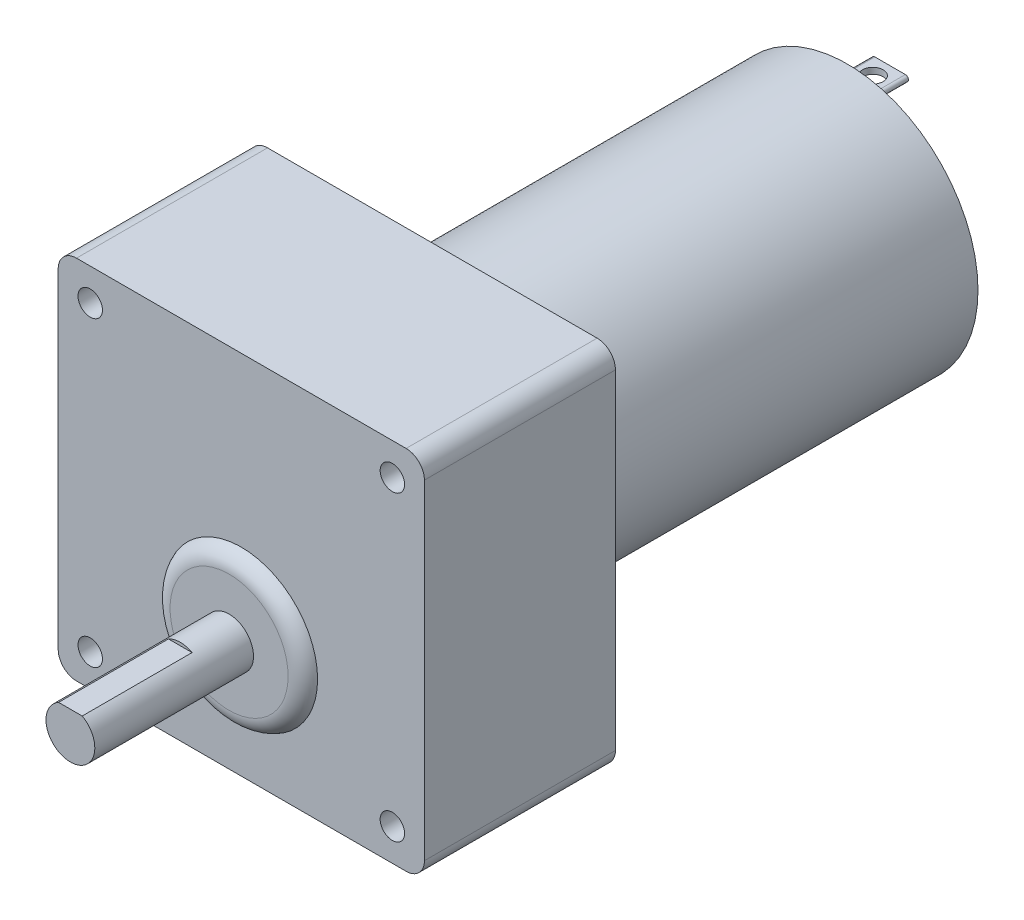
from build123d import *

# Parameters (mm, degrees)
SKETCH1_R           = 21.4
BOSS_EXTRUDE1_DEPTH = 68
SKETCH2_W           = 60
SKETCH2_H           = 60
SKETCH2_R           = 2
BOSS_EXTRUDE2_DEPTH = 31.3
SKETCH3_R           = 12.5
BOSS_EXTRUDE3_DEPTH = 2
FILLET1_R           = 3
SKETCH4_R           = 4
BOSS_EXTRUDE4_DEPTH = 8
BOSS_EXTRUDE5_DEPTH = 18
FILLET2_R           = 3
BOSS_EXTRUDE6_DEPTH = 7
CUT_EXTRUDE1_REACH  = 141.197
SKETCH7_R           = 1.686317599


with BuildPart() as part:
    # Sketch1 → Boss-Extrude1 (new body)
    with BuildSketch(Plane.XY):
        Circle(SKETCH1_R)
    extrude(amount=BOSS_EXTRUDE1_DEPTH)

    # Sketch2 → Boss-Extrude2 (add)
    with BuildSketch(Plane.XY.offset(68)):
        Rectangle(SKETCH2_W, SKETCH2_H)
        with Locations((-24.75, 24.75)):
            Circle(SKETCH2_R, mode=Mode.SUBTRACT)
        with Locations((24.75, 24.75)):
            Circle(SKETCH2_R, mode=Mode.SUBTRACT)
        with Locations(Location((24.75, -24.75, 0), (0, 0, 180))):
            Circle(SKETCH2_R, mode=Mode.SUBTRACT)
        with Locations(Location((-24.75, -24.75, 0), (0, 0, 180))):
            Circle(SKETCH2_R, mode=Mode.SUBTRACT)
    extrude(amount=BOSS_EXTRUDE2_DEPTH)

    # Sketch3 → Boss-Extrude3 (add)
    with BuildSketch(Plane.XY.offset(99.3)):
        with Locations((0, -10)):
            Circle(SKETCH3_R)
    extrude(amount=BOSS_EXTRUDE3_DEPTH)

    # Fillet1
    # the kernel refuses this fillet: 3 mm, written as the material it takes off along each edge
    with BuildSketch(Plane(origin=(0, -10, 101.3), x_dir=(1, 0, 0), z_dir=(0, -1, 0))) as fillet1_piece_1:
        with BuildLine():
            CenterArc((9.671572875, -3), FILLET1_R, 19.471220634, 70.528779366)
            Line((9.671572875, 0), (9.671572875, 0.06))
            Line((9.671572875, 0.06), (12.5, 0.06))
            Line((12.5, 0.06), (12.56, 0))
            ThreePointArc((12.56, 0), (12.56, -1), (12.556568542, -1.98))
            Line((12.556568542, -1.98), (12.5, -2))
        make_face()
    revolve(axis=Axis((0, -10, 101.3), (0, 0, 1)), mode=Mode.SUBTRACT)

    # Sketch4 → Boss-Extrude4 (add)
    with BuildSketch(Plane.XY.offset(101.3)):
        with Locations((0, -10)):
            Circle(SKETCH4_R)
    extrude(amount=BOSS_EXTRUDE4_DEPTH)

    # Sketch5 → Boss-Extrude5 (add)
    with BuildSketch(Plane.XY.offset(109.3)):
        with BuildLine():
            Line((1.936491673, -6.5), (-1.936491673, -6.5))
            ThreePointArc((-1.936491673, -6.5), (-2.031506006, -13.445719569), (4, -10))
            ThreePointArc((4, -10), (3.445719569, -7.968493994), (1.936491673, -6.5))
        make_face()
    extrude(amount=BOSS_EXTRUDE5_DEPTH)

    # Fillet2
    fillet2_edges = [part.edges().sort_by_distance(p)[0] for p in [
        (-30, -30, 83.65),
        (30, -30, 83.65),
        (30, 30, 83.65),
        (-30, 30, 83.65),
    ]]
    fillet(fillet2_edges, radius=FILLET2_R)

    # Sketch6 → Boss-Extrude6 (add)
    with BuildSketch(Plane(origin=(0, 0, 0), x_dir=(-1, 0, 0), z_dir=(0, 0, -1))):
        with BuildLine():
            Line((-2.5, 17.65), (2.5, 17.65))
            ThreePointArc((2.5, 17.65), (3, 17.15), (2.5, 16.65))
            Line((2.5, 16.65), (-2.5, 16.65))
            ThreePointArc((-2.5, 16.65), (-3, 17.15), (-2.5, 17.65))
        make_face()
        with BuildLine():
            Line((-2.5, -17.65), (2.5, -17.65))
            ThreePointArc((2.5, -17.65), (3, -17.15), (2.5, -16.65))
            Line((2.5, -16.65), (-2.5, -16.65))
            ThreePointArc((-2.5, -16.65), (-3, -17.15), (-2.5, -17.65))
        make_face()
    extrude(amount=BOSS_EXTRUDE6_DEPTH)

    # Cut-Extrude1: up to this face of the body (flat: up to its plane)
    cut_extrude1_end = Plane(part.part.faces().sort_by_distance((0, -17.65, -3.5))[0])
    # Sketch7 → Cut-Extrude1 (cut, up to the picked face)
    with BuildSketch(Plane(origin=(0, 17.65, 0), x_dir=(1, 0, 0), z_dir=(0, 1, 0)), mode=Mode.PRIVATE) as cut_extrude1_sk1:
        with Locations(Location((0, 4.176322203, 0), (0, 0, 270))):
            Circle(SKETCH7_R)
    cut_extrude1_tool1 = split(extrude(cut_extrude1_sk1.sketch, amount=-CUT_EXTRUDE1_REACH, mode=Mode.PRIVATE), bisect_by=cut_extrude1_end, keep=Keep.BOTH, mode=Mode.PRIVATE)
    add(cut_extrude1_tool1.solids().sort_by(Axis((0, 17.65, -4.176322), (0, -1, 0)))[0], mode=Mode.SUBTRACT)


solid = part.part
